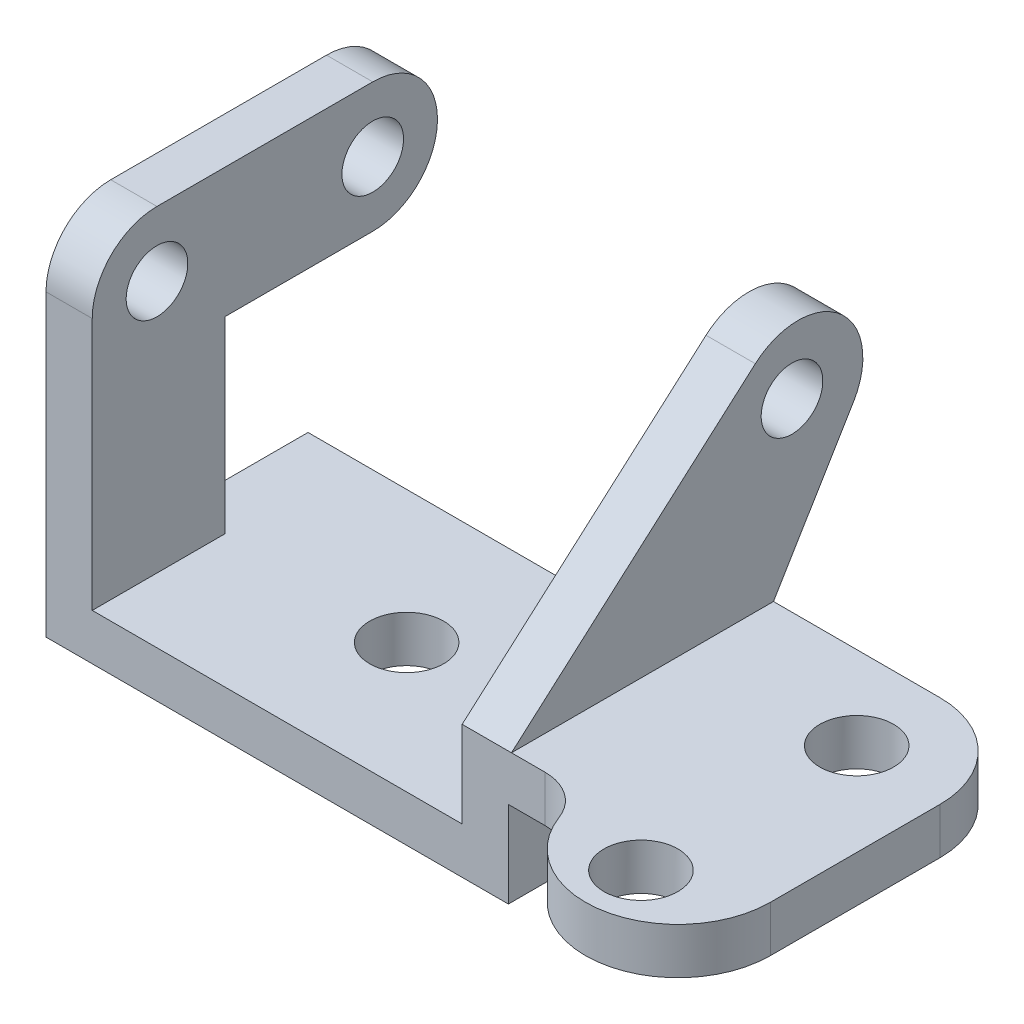
from build123d import *

# Parameters (mm, degrees)
EXTRUDE_THIN1_DEPTH = 85
BOSS_EXTRUDE1_DEPTH = 15
BOSS_EXTRUDE2_DEPTH = 16
FILLET1_R           = 21
BOSS_EXTRUDE3_DEPTH = 15
FILLET2_R           = 16
SKETCH6_R           = 12
CUT_EXTRUDE2_DEPTH  = 272.746205125
FILLET3_R           = 30
SKETCH7_R           = 12
CUT_EXTRUDE3_DEPTH  = 281.766807155
SKETCH9_R           = 10
CUT_EXTRUDE4_DEPTH  = 287.609490422


with BuildPart() as part:
    # Sketch1 → Extrude-Thin1 (new body)
    with BuildSketch(Plane.XY):
        Polygon((0, 0), (150, 0), (150, 28), (235, 28), (235, 43), (135, 43), (135, 15), (0, 15), align=None)
    extrude(amount=-EXTRUDE_THIN1_DEPTH)

    # Sketch2 → Boss-Extrude1 (add)
    with BuildSketch(Plane.ZY):
        Polygon((0, 15), (0, 118), (-112, 118), (-112, 76), (-43, 76), (-43, 15), align=None)
    extrude(amount=-BOSS_EXTRUDE1_DEPTH)

    # Sketch3 → Boss-Extrude2 (add)
    with BuildSketch(Plane.ZY.offset(-135)):
        with BuildLine():
            Line((0, 43), (-79.111854281, 112.751806515))
            ThreePointArc((-79.111854281, 112.751806515), (-106.449245092, 113.128168106), (-110.990788091, 86.168031394))
            Line((-110.990788091, 86.168031394), (-85, 43))
            Line((-85, 43), (0, 43))
        make_face()
    extrude(amount=-BOSS_EXTRUDE2_DEPTH)

    # Fillet1
    fillet1_edges = [part.edges().sort_by_distance(p)[0] for p in [
        (7.5, 76, -112),
        (7.5, 118, -112),
        (7.5, 118, 0),
    ]]
    fillet(fillet1_edges, radius=FILLET1_R - 0.0001)  # a hair under: the kernel refuses the full size

    # Sketch5 → Boss-Extrude3 (add)
    with BuildSketch(Plane(origin=(0, 43, 0), x_dir=(1, 0, 0), z_dir=(0, 1, 0))):
        with BuildLine():
            Line((175, 0), (235, 0))
            ThreePointArc((235, 0), (205, -30), (175, 0))
        make_face()
    extrude(amount=-BOSS_EXTRUDE3_DEPTH)

    # Fillet2
    fillet2_edges = [part.edges().sort_by_distance(p)[0] for p in [
        (175, 35.5, 0),
    ]]
    fillet(fillet2_edges, radius=FILLET2_R)

    # Sketch6 → Cut-Extrude2 (cut, through all)
    with BuildSketch(Plane(origin=(0, 43, 0), x_dir=(1, 0, 0), z_dir=(0, 1, 0))):
        with Locations(Location((205, -12, 0), (0, 0, 270))):
            Circle(SKETCH6_R)
        with Locations(Location((205, 58, 0), (0, 0, 270))):
            Circle(SKETCH6_R)
    extrude(amount=-CUT_EXTRUDE2_DEPTH, mode=Mode.SUBTRACT)

    # Fillet3
    fillet3_edges = [part.edges().sort_by_distance(p)[0] for p in [
        (235, 35.5, -85),
    ]]
    fillet(fillet3_edges, radius=FILLET3_R)

    # Sketch7 → Cut-Extrude3 (cut, through all)
    with BuildSketch(Plane(origin=(0, 15, 0), x_dir=(1, 0, 0), z_dir=(0, 1, 0))):
        with Locations(Location((75, 42, 0), (0, 0, 270))):
            Circle(SKETCH7_R)
    extrude(amount=-CUT_EXTRUDE3_DEPTH, mode=Mode.SUBTRACT)

    # Sketch9 → Cut-Extrude4 (cut, through all)
    with BuildSketch(Plane.ZY):
        with Locations((-91, 97)):
            Circle(SKETCH9_R)
        with Locations((-21, 97)):
            Circle(SKETCH9_R)
    extrude(amount=-CUT_EXTRUDE4_DEPTH, mode=Mode.SUBTRACT)


solid = part.part
